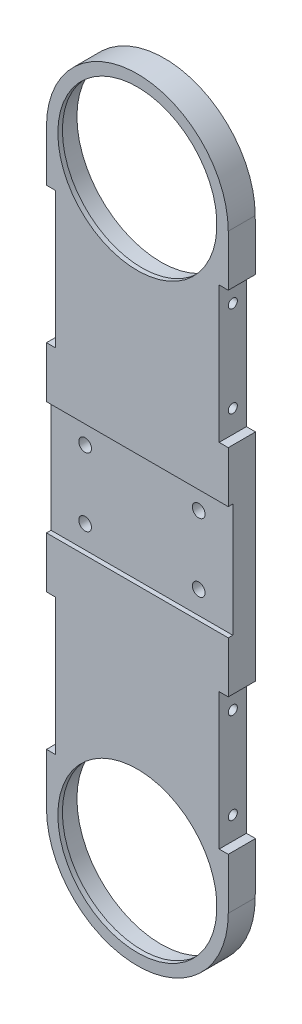
from build123d import *

# Parameters (mm, degrees)
EXTRUDE_1_DEPTH      = 6
SKETCH_2_R           = 18.5
CUT_EXTRUDE_1_DEPTH  = 5
CHAMFER_1_SIZE       = 1.640243073
CHAMFER_1_SIZE_2     = 0.8
SKETCH_18_W          = 40
SKETCH_18_H          = 25
CUT_EXTRUDE_9_DEPTH  = 1
SKETCH_19_R          = 1.4
CUT_EXTRUDE_10_DEPTH = 152.410039297
SKETCH_20_R          = 2.25
CUT_EXTRUDE_11_DEPTH = 0.7
SKETCH_21_W          = 4
SKETCH_21_H          = 30
CUT_EXTRUDE_12_DEPTH = 152.446360141
SKETCH_22_R          = 1
CUT_EXTRUDE_13_DEPTH = 6
CUT_EXTRUDE_START    = -6
SKETCH_23_R          = 1
CUT_EXTRUDE_14_DEPTH = 6
SKETCH_24_R          = 17.5
CUT_EXTRUDE_15_DEPTH = 152.410039297


with BuildPart() as part:
    # 스케치1 → 보스-돌출1 (new body)
    with BuildSketch(Plane.XY):
        with BuildLine():
            Line((-20, 0), (-20, 130))
            ThreePointArc((-20, 130), (0, 150), (20, 130))
            Line((20, 130), (20, 0))
            ThreePointArc((20, 0), (0, -20), (-20, 0))
        make_face()
    extrude(amount=EXTRUDE_1_DEPTH)

    # 스케치2 → 컷-돌출1 (cut)
    with BuildSketch(Plane(origin=(0, 0, 0), x_dir=(-1, 0, 0), z_dir=(0, 0, -1))):
        Circle(SKETCH_2_R)
        with Locations((0, 130)):
            Circle(SKETCH_2_R)
    extrude(amount=-CUT_EXTRUDE_1_DEPTH, mode=Mode.SUBTRACT)

    # 모따기1
    # the kernel refuses this chamfer: 1.640243073, 0.8 mm, written as the material it takes off along each edge
    with BuildSketch(Plane(origin=(0, 130, 0), x_dir=(-1, 0, 0), z_dir=(0, -1, 0))) as chamfer_1_piece_1:
        Polygon((18.5 + CHAMFER_1_SIZE, 0), (18.5, -CHAMFER_1_SIZE_2), (18.5, 0), align=None)
    revolve(axis=Axis((0, 130, 0), (0, 0, -1)), mode=Mode.SUBTRACT)
    with BuildSketch(Plane(origin=(0, 0, 0), x_dir=(-1, 0, 0), z_dir=(0, -1, 0))) as chamfer_1_piece_2:
        Polygon((18.5 + CHAMFER_1_SIZE, 0), (18.5, -CHAMFER_1_SIZE_2), (18.5, 0), align=None)
    revolve(axis=Axis((0, 0, 0), (0, 0, -1)), mode=Mode.SUBTRACT)

    # 스케치18 → 컷-돌출9 (cut)
    with BuildSketch(Plane.XY.offset(6)):
        with Locations((0, 65)):
            Rectangle(SKETCH_18_W, SKETCH_18_H)
    extrude(amount=-CUT_EXTRUDE_9_DEPTH, mode=Mode.SUBTRACT)

    # 스케치19 → 컷-돌출10 (cut, through all)
    with BuildSketch(Plane.XY.offset(5)):
        with Locations((-12.5, 72.5)):
            Circle(SKETCH_19_R)
        with Locations((12.5, 72.5)):
            Circle(SKETCH_19_R)
        with Locations((-12.5, 57.5)):
            Circle(SKETCH_19_R)
        with Locations((12.5, 57.5)):
            Circle(SKETCH_19_R)
    extrude(amount=-CUT_EXTRUDE_10_DEPTH, mode=Mode.SUBTRACT)

    # 스케치20 → 컷-돌출11 (cut)
    with BuildSketch(Plane(origin=(0, 0, 0), x_dir=(-1, 0, 0), z_dir=(0, 0, -1))):
        with Locations((-12.5, 72.5)):
            Circle(SKETCH_20_R)
        with Locations((12.5, 72.5)):
            Circle(SKETCH_20_R)
        with Locations((-12.5, 57.5)):
            Circle(SKETCH_20_R)
        with Locations((12.5, 57.5)):
            Circle(SKETCH_20_R)
    extrude(amount=-CUT_EXTRUDE_11_DEPTH, mode=Mode.SUBTRACT)

    # 스케치21 → 컷-돌출12 (cut, through all)
    with BuildSketch(Plane.XY.offset(6)):
        with Locations((-20, 103.75)):
            Rectangle(SKETCH_21_W, SKETCH_21_H)
        with Locations((20, 103.75)):
            Rectangle(SKETCH_21_W, SKETCH_21_H)
        with Locations((-20, 26.25)):
            Rectangle(SKETCH_21_W, SKETCH_21_H)
        with Locations((20, 26.25)):
            Rectangle(SKETCH_21_W, SKETCH_21_H)
    extrude(amount=-CUT_EXTRUDE_12_DEPTH, mode=Mode.SUBTRACT)

    # 스케치22 → 컷-돌출13 (cut)
    with BuildSketch(Plane(origin=(18, 0, 0), x_dir=(0, 0, -1), z_dir=(1, 0, 0))):
        with Locations(Location((-3, 16.25, 0), (0, 0, 90))):
            Circle(SKETCH_22_R)
        with Locations(Location((-3, 36.25, 0), (0, 0, 90))):
            Circle(SKETCH_22_R)
        with Locations(Location((-3, 113.75, 0), (0, 0, 90))):
            Circle(SKETCH_22_R)
        with Locations(Location((-3, 93.75, 0), (0, 0, 90))):
            Circle(SKETCH_22_R)
    extrude(amount=-CUT_EXTRUDE_13_DEPTH, mode=Mode.SUBTRACT)

    # 스케치23 → 컷-돌출14 (cut)
    with BuildSketch(Plane.ZY.offset(18).offset(CUT_EXTRUDE_START)):
        with Locations(Location((3, 16.25, 0), (0, 0, 90))):
            Circle(SKETCH_23_R)
        with Locations(Location((3, 36.25, 0), (0, 0, 90))):
            Circle(SKETCH_23_R)
        with Locations(Location((3, 113.75, 0), (0, 0, 90))):
            Circle(SKETCH_23_R)
        with Locations(Location((3, 93.75, 0), (0, 0, 90))):
            Circle(SKETCH_23_R)
    extrude(amount=CUT_EXTRUDE_14_DEPTH, mode=Mode.SUBTRACT)

    # 스케치24 → 컷-돌출15 (cut, through all)
    with BuildSketch(Plane(origin=(0, 0, 5), x_dir=(-1, 0, 0), z_dir=(0, 0, -1))):
        with Locations((0, 130)):
            Circle(SKETCH_24_R)
        Circle(SKETCH_24_R)
    extrude(amount=-CUT_EXTRUDE_15_DEPTH, mode=Mode.SUBTRACT)


solid = part.part
